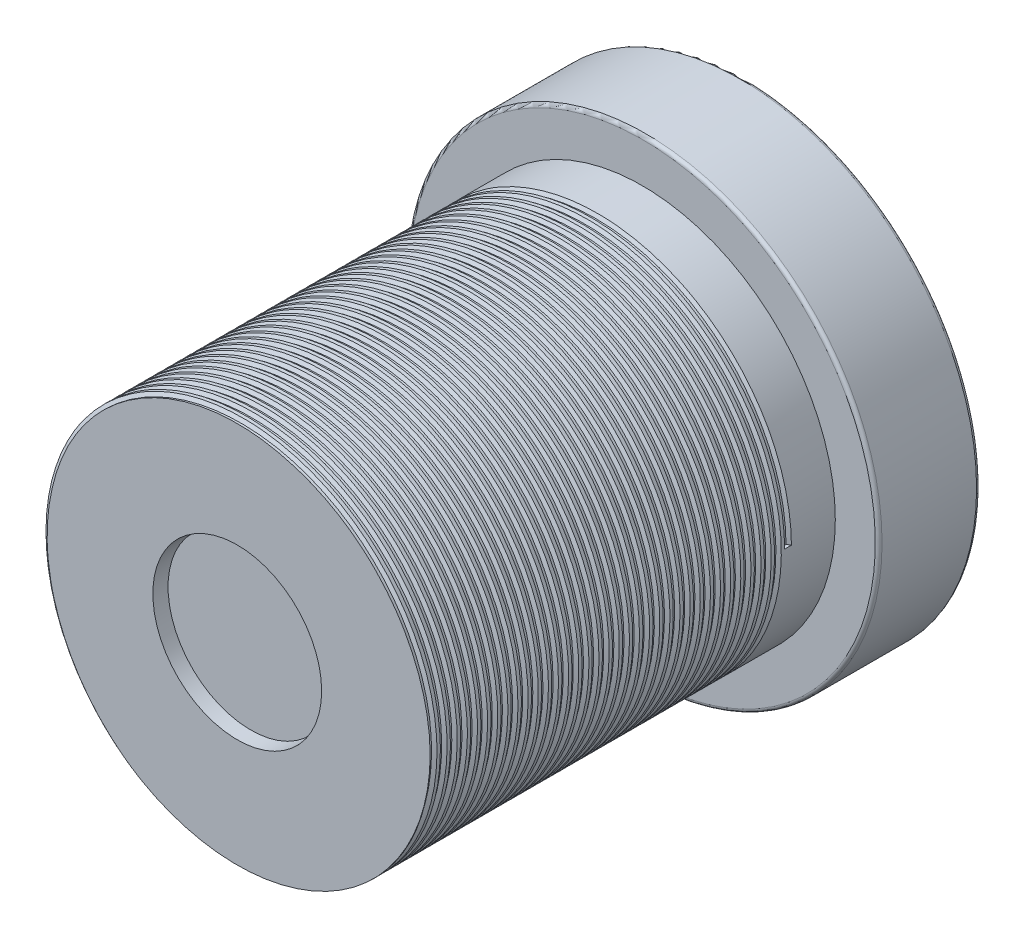
from build123d import *

# Parameters (mm, degrees)
SKETCH_1_R      = 5.715
SKETCH_1_R_2    = 2.5
EXTRUDE_1_DEPTH = 12
SKETCH_2_R      = 2.45
EXTRUDE_2_DEPTH = 0.1
SKETCH_3_R      = 7
SKETCH_3_R_2    = 4
EXTRUDE_3_DEPTH = 3
CHAMFER_1_SIZE  = 1.5
CHAMFER_1_SIZE2 = 0.866025404
SKETCH_4_R      = 3.95
EXTRUDE_4_DEPTH = 0.1
SWEEP_1_PITCH   = 0.3
FILLET_1_R      = 0.1


with BuildPart() as part:
    # 草图1 → 凸台-拉伸1 (new body)
    with BuildSketch(Plane.XY):
        Circle(SKETCH_1_R)
        Circle(SKETCH_1_R_2, mode=Mode.SUBTRACT)
    extrude(amount=EXTRUDE_1_DEPTH)

    # 草图3 → 凸台-拉伸3 (add)
    with BuildSketch(Plane(origin=(0, 0, 0), x_dir=(-1, 0, 0), z_dir=(0, 0, -1))):
        Circle(SKETCH_3_R)
        Circle(SKETCH_3_R_2, mode=Mode.SUBTRACT)
    extrude(amount=EXTRUDE_3_DEPTH)

    # 倒角1
    chamfer_1_edges = [part.edges().sort_by_distance(p)[0] for p in [
        (4, 0, -3),
    ]]
    chamfer_1_side = [part.faces().sort_by_distance(p)[0] for p in [
        (6.802010101, 0, -3),
    ]]
    chamfer(chamfer_1_edges, length=CHAMFER_1_SIZE, length2=CHAMFER_1_SIZE2, reference=chamfer_1_side[0])

    # 切除-扫描1: arcs per turn and ends read off the stored shape
    # 切除-扫描1: the profile of 草图6 profile screwed along a right-hand helix through 36 turns, 6 arcs to a turn; built about Z, then put on its axis
    sweep_1_z = Axis((0, 0, 0), (0, 0, 1))
    sweep_1_corners = [(5.7153, 0, -0.30018), (5.7153, 0, -0.09982), (5.615, 0, -0.16), (5.615, 0, -0.24)]
    with BuildLine(mode=Mode.PRIVATE) as sweep_1_profile:
        Line(sweep_1_corners[0], sweep_1_corners[1])
        Line(sweep_1_corners[1], sweep_1_corners[2])
        Line(sweep_1_corners[2], sweep_1_corners[3])
        Line(sweep_1_corners[3], sweep_1_corners[0])
    sweep_1_cap = Face(sweep_1_profile.wire())
    sweep_1_turn_angles = [0, 30, 60, 90, 120, 150, 180, 210, 240, 270, 300, 330, 360]
    sweep_1_turn_weights = [1, 0.8660254037844387, 1, 0.8660254037844387, 1, 0.8660254037844387, 1, 0.8660254037844387, 1, 0.8660254037844387, 1, 0.8660254037844387, 1]
    sweep_1_turn_rails = [Edge.make_bspline([Vector(p[0], p[1], 0).rotate(sweep_1_z, sweep_1_turn_angles[k]) / sweep_1_turn_weights[k] + Vector(0, 0, p[2] + SWEEP_1_PITCH * sweep_1_turn_angles[k] / 360) for k in range(13)], [0, 0, 0, 1, 1, 2, 2, 3, 3, 4, 4, 5, 5, 6, 6, 6], 2, sweep_1_turn_weights) for p in sweep_1_corners]
    sweep_1_turn_sides = [Face.make_surface_from_curves(sweep_1_turn_rails[p[0]], sweep_1_turn_rails[p[1]]) for p in [(0, 1), (1, 2), (2, 3), (3, 0)]]
    sweep_1 = Plane(origin=(0, 0, 12), x_dir=(1, 0, 0), z_dir=(0, 0, -1)) * Solid(Shell([*[p.moved(Location((0, 0, SWEEP_1_PITCH * i))) for i in range(36) for p in sweep_1_turn_sides], sweep_1_cap, sweep_1_cap.rotate(sweep_1_z, 12960).moved(Location((0, 0, SWEEP_1_PITCH * 12960 / 360)))]))
    add(sweep_1, mode=Mode.SUBTRACT)

    # 圆角1
    fillet_1_edges = [part.edges().sort_by_distance(p)[0] for p in [
        (7, 0, -3),
        (7, 0, 0),
    ]]
    fillet(fillet_1_edges, radius=FILLET_1_R)


with BuildPart() as body_2:
    # 草图2 → 凸台-拉伸2 (new body)
    with BuildSketch(Plane.XY.offset(11.5)):
        Circle(SKETCH_2_R)
    extrude(amount=EXTRUDE_2_DEPTH)


with BuildPart() as body_3:
    # 草图4 → 凸台-拉伸4 (new body)
    with BuildSketch(Plane(origin=(0, 0, -1.5), x_dir=(-1, 0, 0), z_dir=(0, 0, -1))):
        Circle(SKETCH_4_R)
    extrude(amount=EXTRUDE_4_DEPTH)


solid = Compound([part.part, body_2.part, body_3.part])
